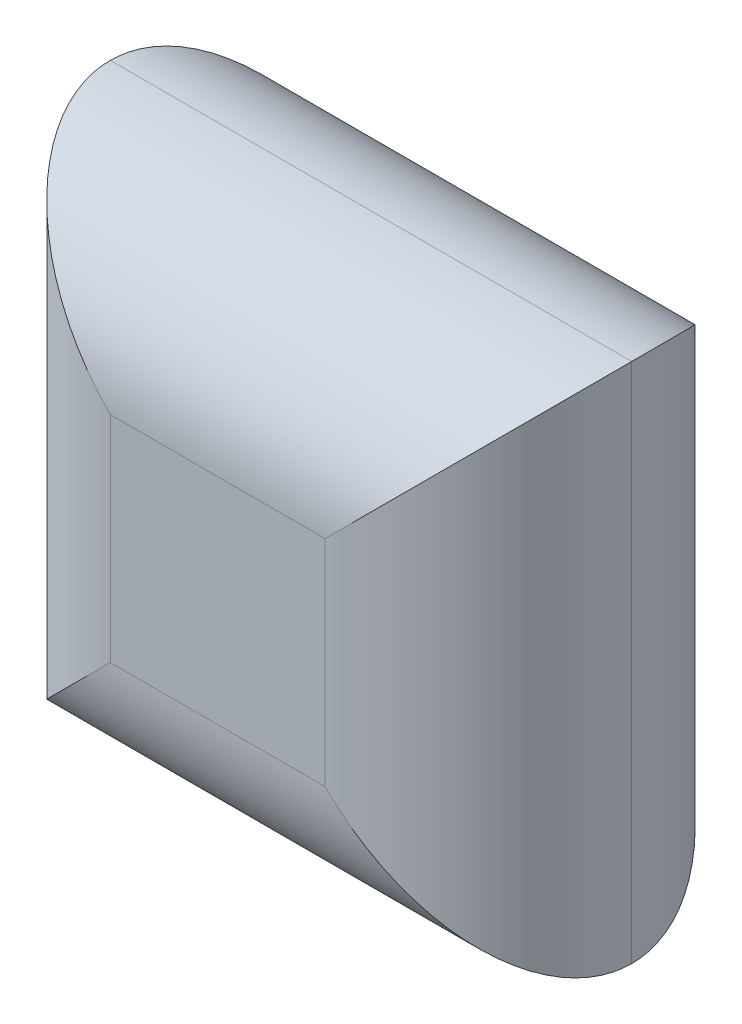
from build123d import *

# Parameters (mm, degrees)
SKETCH1_W           = 170
SKETCH1_H           = 170
BOSS_EXTRUDE1_DEPTH = 100
FILLET1_R           = 50


with BuildPart() as part:
    # Sketch1 → Boss-Extrude1 (new body)
    with BuildSketch(Plane.XY):
        with Locations((85, 85)):
            Rectangle(SKETCH1_W, SKETCH1_H)
    extrude(amount=BOSS_EXTRUDE1_DEPTH)

    # Fillet1
    fillet1_edges = [part.edges().sort_by_distance(p)[0] for p in [
        (85, 0, 0),
        (170, 85, 0),
        (85, 170, 0),
        (0, 85, 0),
        (85, 170, 100),
        (170, 85, 100),
        (85, 0, 100),
        (0, 85, 100),
    ]]
    fillet(fillet1_edges, radius=FILLET1_R - 0.0001)  # a hair under: the kernel refuses the full size


solid = part.part
